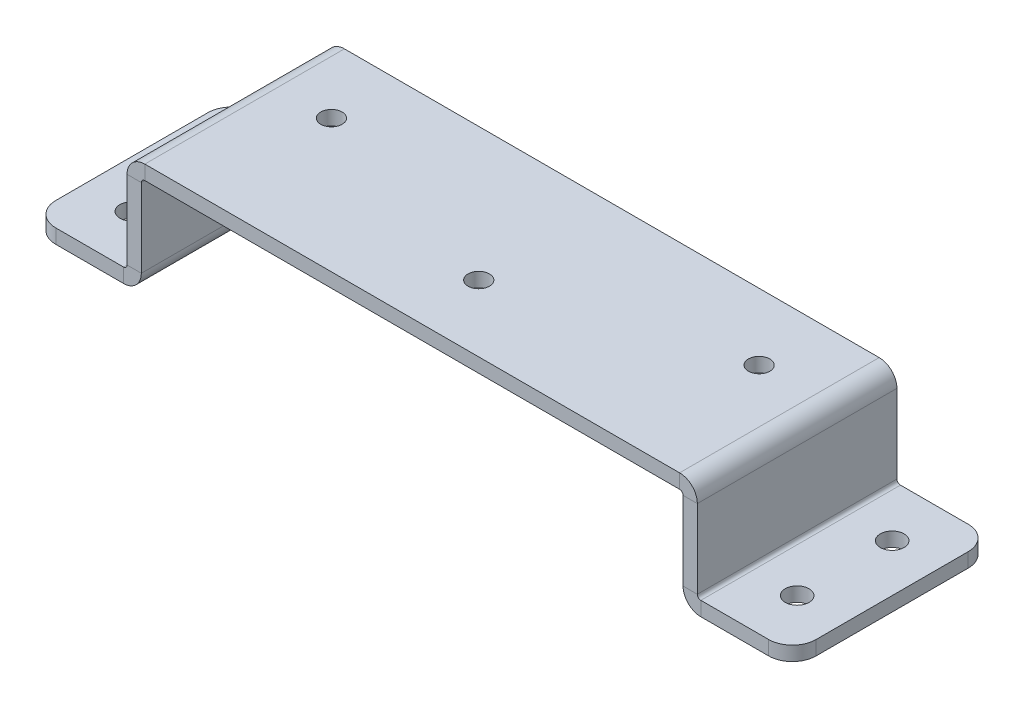
from build123d import *

# Parameters (mm, degrees)
SKETCH_1_W                         = 120
SKETCH_1_H                         = 42
SM_BASE_FLANGE_1_DEPTH             = 3
SM_EDGE_FLANGE_1_STRIP_W           = 13.4732
SM_EDGE_FLANGE_1_STRIP_H           = 3
SM_EDGE_FLANGE_1_STRIP_CUT_DEPTH   = 42
SM_EDGE_FLANGE_1_STRIP_2_W         = 13.4732
SM_EDGE_FLANGE_1_STRIP_2_H         = 3
SM_EDGE_FLANGE_1_STRIP_CUT_2_DEPTH = 42
SM_EDGE_FLANGE_1_DEPTH             = 42
SM_EDGE_FLANGE_1_BEND_DEPTH        = 42
SM_EDGE_FLANGE_2_STRIP_W           = 13.4732
SM_EDGE_FLANGE_2_STRIP_H           = 3
SM_EDGE_FLANGE_2_STRIP_CUT_DEPTH   = 42
SM_EDGE_FLANGE_2_STRIP_2_W         = 13.4732
SM_EDGE_FLANGE_2_STRIP_2_H         = 3
SM_EDGE_FLANGE_2_STRIP_CUT_2_DEPTH = 42
SM_EDGE_FLANGE_2_DEPTH             = 42
SM_EDGE_FLANGE_2_BEND_DEPTH        = 42
FILLET_1_R                         = 5
HOLE_WIZARD_M6_1_D                 = 5
HOLE_WIZARD_M4_1_D                 = 4.5


# Sheet-metal steps are written as plain solids
with BuildPart() as part:
    # Sketch 1 → 베이스-플랜지1 (new body)
    with BuildSketch(Plane(origin=(0, 0, 0), x_dir=(1, 0, 0), z_dir=(0, 1, 0))):
        Rectangle(SKETCH_1_W, SKETCH_1_H)
    extrude(amount=-SM_BASE_FLANGE_1_DEPTH)

    # 모서리 플랜지1 strip (across the edge) → 모서리 플랜지1 strip cut (cut)
    with BuildSketch(Plane(origin=(-60, -3, 21), x_dir=(1, 0, 0), z_dir=(0, 0, -1))):
        with Locations((-3, -1.5)):
            Rectangle(SM_EDGE_FLANGE_1_STRIP_W, SM_EDGE_FLANGE_1_STRIP_H)
    extrude(amount=SM_EDGE_FLANGE_1_STRIP_CUT_DEPTH, mode=Mode.SUBTRACT)

    # 모서리 플랜지1 strip 2 (across the edge) → 모서리 플랜지1 strip cut 2 (cut)
    with BuildSketch(Plane(origin=(60, -3, -21), x_dir=(-1, 0, 0), z_dir=(0, 0, 1))):
        with Locations((-3, -1.5)):
            Rectangle(SM_EDGE_FLANGE_1_STRIP_2_W, SM_EDGE_FLANGE_1_STRIP_2_H)
    extrude(amount=SM_EDGE_FLANGE_1_STRIP_CUT_2_DEPTH, mode=Mode.SUBTRACT)

    # 모서리 플랜지1 section (across the edge) → 모서리 플랜지1 (add)
    with BuildSketch(Plane(origin=(-60, -3, 21), x_dir=(1, 0, 0), z_dir=(0, 0, -1))):
        with BuildLine():
            Line((0, 0.7366), (0, 21))
            Line((0, 21), (3, 21))
            Line((3, 21), (3, 0.7366))
            ThreePointArc((3, 0.7366), (3.215745145, 0.215745145), (3.7366, 0))
            Line((3.7366, 0), (3.7366, -3))
            ThreePointArc((3.7366, -3), (1.094424801, -1.905575199), (0, 0.7366))
        make_face()
    extrude(amount=SM_EDGE_FLANGE_1_DEPTH)

    # 모서리 플랜지1 section 2 (across the edge) → 모서리 플랜지1 bend (add)
    with BuildSketch(Plane(origin=(60, -3, -21), x_dir=(-1, 0, 0), z_dir=(0, 0, 1))):
        with BuildLine():
            Line((0, 0.7366), (0, 21))
            Line((0, 21), (3, 21))
            Line((3, 21), (3, 0.7366))
            ThreePointArc((3, 0.7366), (3.215745145, 0.215745145), (3.7366, 0))
            Line((3.7366, 0), (3.7366, -3))
            ThreePointArc((3.7366, -3), (1.094424801, -1.905575199), (0, 0.7366))
        make_face()
    extrude(amount=SM_EDGE_FLANGE_1_BEND_DEPTH)

    # 모서리 플랜지2 strip (across the edge) → 모서리 플랜지2 strip cut (cut)
    with BuildSketch(Plane(origin=(-60, -24, -21), x_dir=(0, 1, 0), z_dir=(0, 0, 1))):
        with Locations((-3, -1.5)):
            Rectangle(SM_EDGE_FLANGE_2_STRIP_W, SM_EDGE_FLANGE_2_STRIP_H)
    extrude(amount=SM_EDGE_FLANGE_2_STRIP_CUT_DEPTH, mode=Mode.SUBTRACT)

    # 모서리 플랜지2 strip 2 (across the edge) → 모서리 플랜지2 strip cut 2 (cut)
    with BuildSketch(Plane(origin=(60, -24, 21), x_dir=(0, 1, 0), z_dir=(0, 0, -1))):
        with Locations((-3, -1.5)):
            Rectangle(SM_EDGE_FLANGE_2_STRIP_2_W, SM_EDGE_FLANGE_2_STRIP_2_H)
    extrude(amount=SM_EDGE_FLANGE_2_STRIP_CUT_2_DEPTH, mode=Mode.SUBTRACT)

    # 모서리 플랜지2 section (across the edge) → 모서리 플랜지2 (add)
    with BuildSketch(Plane(origin=(-60, -24, -21), x_dir=(0, 1, 0), z_dir=(0, 0, 1))):
        with BuildLine():
            Line((0, 0.7366), (0, 20))
            Line((0, 20), (3, 20))
            Line((3, 20), (3, 0.7366))
            ThreePointArc((3, 0.7366), (3.215745145, 0.215745145), (3.7366, 0))
            Line((3.7366, 0), (3.7366, -3))
            ThreePointArc((3.7366, -3), (1.094424801, -1.905575199), (0, 0.7366))
        make_face()
    extrude(amount=SM_EDGE_FLANGE_2_DEPTH)

    # 모서리 플랜지2 section 2 (across the edge) → 모서리 플랜지2 bend (add)
    with BuildSketch(Plane(origin=(60, -24, 21), x_dir=(0, 1, 0), z_dir=(0, 0, -1))):
        with BuildLine():
            Line((0, 0.7366), (0, 20))
            Line((0, 20), (3, 20))
            Line((3, 20), (3, 0.7366))
            ThreePointArc((3, 0.7366), (3.215745145, 0.215745145), (3.7366, 0))
            Line((3.7366, 0), (3.7366, -3))
            ThreePointArc((3.7366, -3), (1.094424801, -1.905575199), (0, 0.7366))
        make_face()
    extrude(amount=SM_EDGE_FLANGE_2_BEND_DEPTH)

    # 필렛1
    fillet_1_edges = [part.edges().sort_by_distance(p)[0] for p in [
        (-80, -22.5, -21),
        (-80, -22.5, 21),
        (80, -22.5, 21),
        (80, -22.5, -21),
    ]]
    fillet(fillet_1_edges, radius=FILLET_1_R)

    # M6 탭을 위한 탭 드릴1 (through all)
    with Locations(Plane(origin=(0, -24, 0), x_dir=(-1, 0, 0), z_dir=(0, -1, 0))):
        with Locations((-70, 10), (-70, -10), (70, 10), (70, -10)):
            Hole(HOLE_WIZARD_M6_1_D / 2)

    # M4 여유 구멍1 (through all)
    with Locations(Plane(origin=(0, 0, 0), x_dir=(1, 0, 0), z_dir=(0, 1, 0))):
        with Locations((-45, 7), (0, -7), (45, 7)):
            Hole(HOLE_WIZARD_M4_1_D / 2)


solid = part.part
